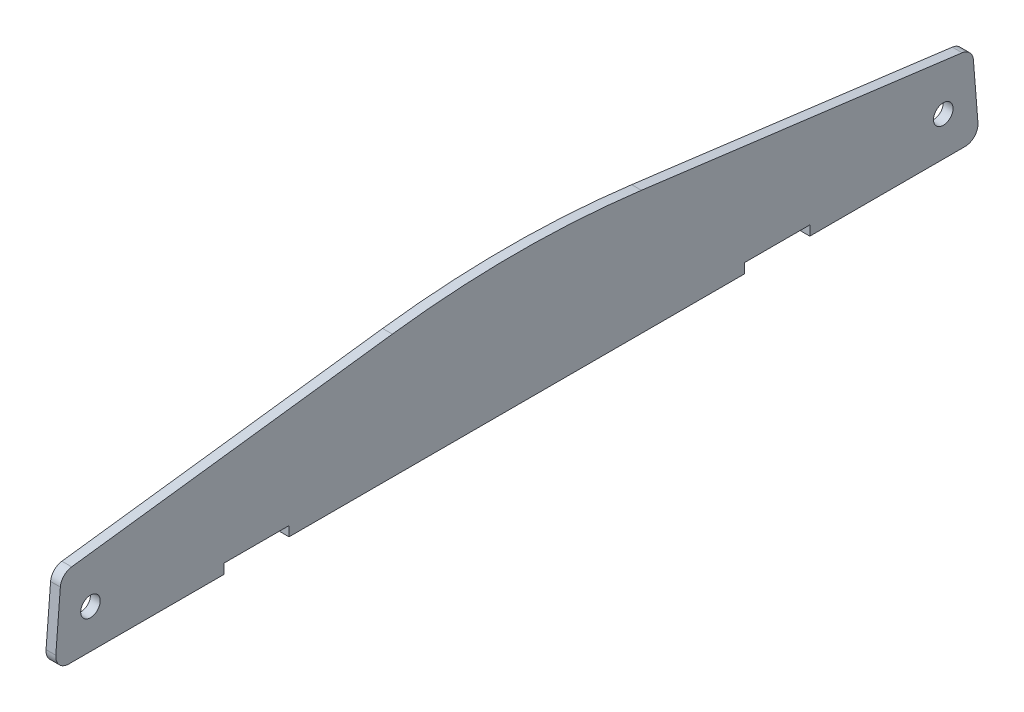
from build123d import *

# Parameters (mm, degrees)
SZKIC1_R                    = 3
DODANIE_WYCI_GNI_CIE1_DEPTH = 3


with BuildPart() as part:
    # Szkic1 → Dodanie-wyciągnięcie1 (new body)
    with BuildSketch(Plane(origin=(0, 0, 0), x_dir=(0, 0, -1), z_dir=(1, 0, 0))):
        with BuildLine():
            Line((-141.730335164, -242.408306522), (-140.334618979, -224.961854206))
            ThreePointArc((-140.334618979, -224.961854206), (-139.242901278, -222.521156066), (-136.857444835, -221.313491994))
            Line((-136.857444835, -221.313491994), (-38.332376397, -208.645983195))
            ThreePointArc((-38.332376397, -208.645983195), (-0.075853635, -206.196715787), (38.180669127, -208.645983195))
            Line((38.180669127, -208.645983195), (136.705737564, -221.313491994))
            ThreePointArc((136.705737564, -221.313491994), (139.091194007, -222.521156066), (140.182911708, -224.961854206))
            Line((140.182911708, -224.961854206), (141.578627894, -242.408306522))
            ThreePointArc((141.578627894, -242.408306522), (140.530407742, -245.440595028), (137.591366779, -246.727287411))
            Line((137.591366779, -246.727287411), (89.924146365, -246.727287411))
            Line((89.924146365, -246.727287411), (89.924146365, -243.727287411))
            Line((89.924146365, -243.727287411), (69.924146365, -243.727287411))
            Line((69.924146365, -243.727287411), (69.924146365, -246.727287411))
            Line((69.924146365, -246.727287411), (-0.075853635, -246.727287411))
            Line((-0.075853635, -246.727287411), (-70.075853635, -246.727287411))
            Line((-70.075853635, -246.727287411), (-70.075853635, -243.727287411))
            Line((-70.075853635, -243.727287411), (-90.075853635, -243.727287411))
            Line((-90.075853635, -243.727287411), (-90.075853635, -246.727287411))
            Line((-90.075853635, -246.727287411), (-137.74307405, -246.727287411))
            ThreePointArc((-137.74307405, -246.727287411), (-140.682115012, -245.440595028), (-141.730335164, -242.408306522))
        make_face()
        with Locations((-131.075853635, -234.727287411)):
            Circle(SZKIC1_R, mode=Mode.SUBTRACT)
        with Locations((130.924146365, -234.727287411)):
            Circle(SZKIC1_R, mode=Mode.SUBTRACT)
    extrude(amount=DODANIE_WYCI_GNI_CIE1_DEPTH)


solid = part.part
